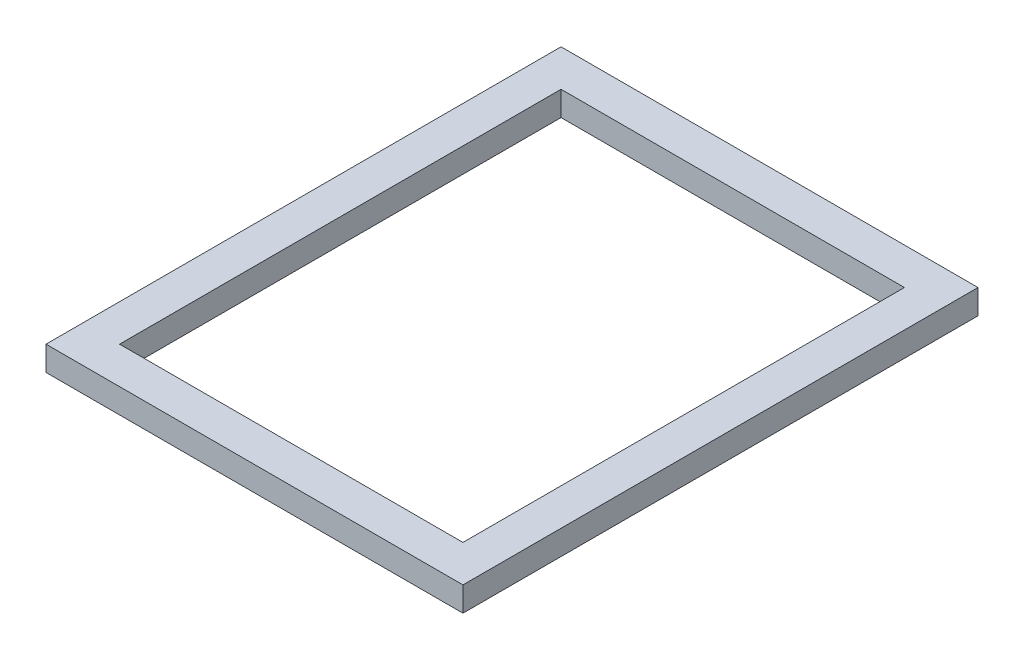
from build123d import *

# Parameters (mm, degrees)
SKETCH1_W           = 26.9875
SKETCH1_H           = 33.3374
SKETCH1_W_2         = 22.225
SKETCH1_H_2         = 28.5749
BOSS_EXTRUDE1_DEPTH = 1.5875


with BuildPart() as part:
    # Sketch1 → Boss-Extrude1 (new body)
    with BuildSketch(Plane(origin=(0, 0, 0), x_dir=(1, 0, 0), z_dir=(0, 1, 0))):
        with Locations((13.49375, 16.6687)):
            Rectangle(SKETCH1_W, SKETCH1_H)
        with Locations((13.49375, 16.6687)):
            Rectangle(SKETCH1_W_2, SKETCH1_H_2, mode=Mode.SUBTRACT)
    extrude(amount=BOSS_EXTRUDE1_DEPTH)


solid = part.part
